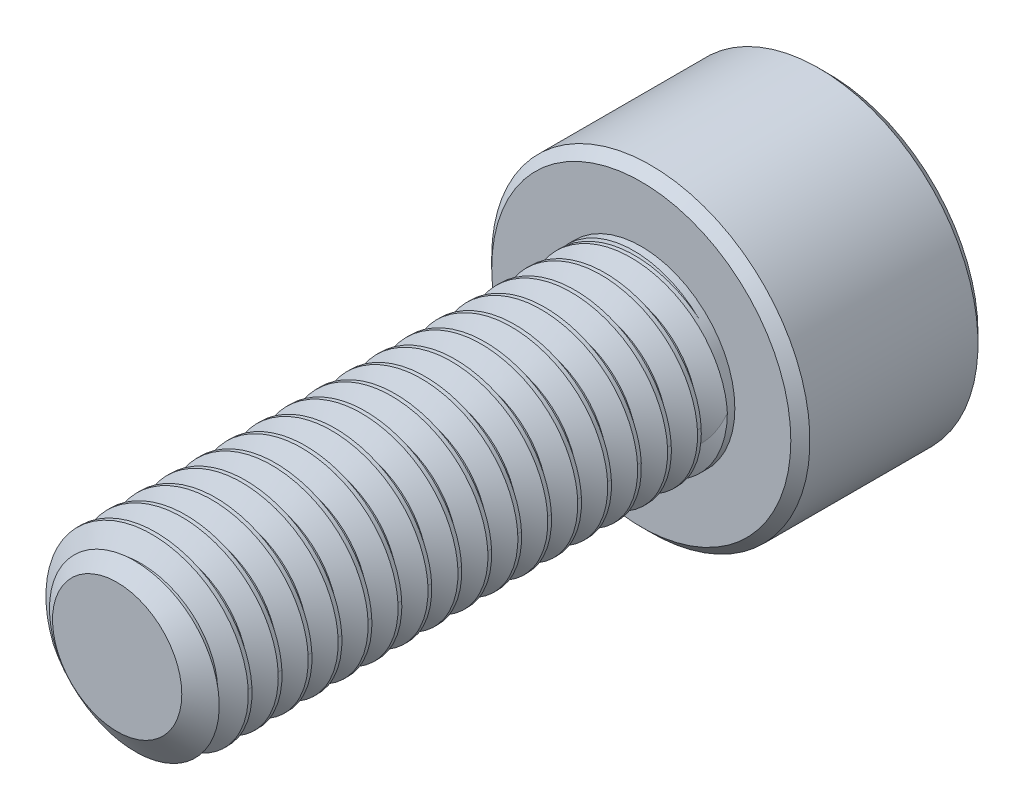
from build123d import *

# Parameters (mm, degrees)
SKETCH1_R          = 2.5
EXTRUDE1_DEPTH     = 14
CUT_SWEEP1_PITCH   = 0.8
SKETCH6_R          = 4.25
EXTRUDE2_DEPTH     = 5
CUT_EXTRUDE1_DEPTH = 3
CHAMFER1_SIZE      = 0.255


with BuildPart() as part:
    # Sketch1 → Extrude1 (new body)
    with BuildSketch(Plane.XY):
        Circle(SKETCH1_R)
    extrude(amount=-EXTRUDE1_DEPTH)

    # Cut-Sweep1: the profile of Sketch3 profile screwed along a right-hand helix of 18.5 turns, 6 arcs to a turn; built about Z, then put on its axis
    cut_sweep1_z = Axis((0, 0, 0), (0, 0, 1))
    cut_sweep1_corners = [(2.5003, 0, -0.700173205), (1.980384758, 0, -0.4), (1.980384758, 0, -0.3), (2.5003, 0, 0.000173205)]
    with BuildLine(mode=Mode.PRIVATE) as cut_sweep1_profile:
        Line(cut_sweep1_corners[0], cut_sweep1_corners[1])
        Line(cut_sweep1_corners[1], cut_sweep1_corners[2])
        Line(cut_sweep1_corners[2], cut_sweep1_corners[3])
        Line(cut_sweep1_corners[3], cut_sweep1_corners[0])
    cut_sweep1_cap = Face(cut_sweep1_profile.wire())
    cut_sweep1_turn_angles = [0, 30, 60, 90, 120, 150, 180, 210, 240, 270, 300, 330, 360]
    cut_sweep1_turn_weights = [1, 0.8660254037844387, 1, 0.8660254037844387, 1, 0.8660254037844387, 1, 0.8660254037844387, 1, 0.8660254037844387, 1, 0.8660254037844387, 1]
    cut_sweep1_turn_rails = [Edge.make_bspline([Vector(p[0], p[1], 0).rotate(cut_sweep1_z, cut_sweep1_turn_angles[k]) / cut_sweep1_turn_weights[k] + Vector(0, 0, p[2] + CUT_SWEEP1_PITCH * cut_sweep1_turn_angles[k] / 360) for k in range(13)], [0, 0, 0, 1, 1, 2, 2, 3, 3, 4, 4, 5, 5, 6, 6, 6], 2, cut_sweep1_turn_weights) for p in cut_sweep1_corners]
    cut_sweep1_turn_sides = [Face.make_surface_from_curves(cut_sweep1_turn_rails[p[0]], cut_sweep1_turn_rails[p[1]]) for p in [(0, 1), (1, 2), (2, 3), (3, 0)]]
    cut_sweep1_last_angles = [6480, 6510, 6540, 6570, 6600, 6630, 6660]
    cut_sweep1_last_weights = [1, 0.8660254037844387, 1, 0.8660254037844387, 1, 0.8660254037843871, 1]
    cut_sweep1_last_rails = [Edge.make_bspline([Vector(p[0], p[1], 0).rotate(cut_sweep1_z, cut_sweep1_last_angles[k]) / cut_sweep1_last_weights[k] + Vector(0, 0, p[2] + CUT_SWEEP1_PITCH * cut_sweep1_last_angles[k] / 360) for k in range(7)], [0, 0, 0, 1, 1, 2, 2, 3, 3, 3], 2, cut_sweep1_last_weights) for p in cut_sweep1_corners]
    cut_sweep1_last_sides = [Face.make_surface_from_curves(cut_sweep1_last_rails[p[0]], cut_sweep1_last_rails[p[1]]) for p in [(0, 1), (1, 2), (2, 3), (3, 0)]]
    cut_sweep1 = Plane(origin=(0, 0, 0), x_dir=(0, 1, 0), z_dir=(0, 0, -1)) * Solid(Shell([*[p.moved(Location((0, 0, CUT_SWEEP1_PITCH * i))) for i in range(18) for p in cut_sweep1_turn_sides], *cut_sweep1_last_sides, cut_sweep1_cap, cut_sweep1_cap.rotate(cut_sweep1_z, 6660).moved(Location((0, 0, CUT_SWEEP1_PITCH * 6660 / 360)))]))
    add(cut_sweep1, mode=Mode.SUBTRACT)

    # Sketch4 → Cut-Revolve1 (revolve, cut)
    with BuildSketch(Plane(origin=(0, 0, 0), x_dir=(0, 0, -1), z_dir=(1, 0, 0)), mode=Mode.PRIVATE) as cut_revolve1_sk:
        Polygon((0.541691224, 2.5), (0, 1.726384758), (0, 2.5), align=None)
    revolve(cut_revolve1_sk.sketch.rotate(Axis((0, 0, 0), (0, 0, -1)), 260.43858876), axis=Axis((0, 0, 0), (0, 0, -1)), mode=Mode.SUBTRACT)

    # Sketch6 → Extrude2 (add)
    with BuildSketch(Plane(origin=(0, 0, -14), x_dir=(-1, 0, 0), z_dir=(0, 0, -1))):
        Circle(SKETCH6_R)
    extrude(amount=EXTRUDE2_DEPTH)

    # Sketch7 → Cut-Extrude1 (cut)
    with BuildSketch(Plane(origin=(0, 0, -19), x_dir=(-1, 0, 0), z_dir=(0, 0, -1))):
        Polygon((0, 2.309401077), (-2, 1.154700538), (-2, -1.154700538), (0, -2.309401077), (2, -1.154700538), (2, 1.154700538), align=None)
    extrude(amount=-CUT_EXTRUDE1_DEPTH, mode=Mode.SUBTRACT)

    # Cut-Extrude2 cone 1 section (through the dimple's axis) → Cut-Extrude2 (revolve, cut)
    with BuildSketch(Plane(origin=(0, 0, -19), x_dir=(0, 1, 0), z_dir=(1, 0, 0))):
        Polygon((0, 0), (2.309401077, 0), (0, 2.309401077), align=None)
    revolve(axis=Axis((0, 0, -19), (0, 0, 1)), mode=Mode.SUBTRACT)

    # Chamfer1
    chamfer1_edges = [part.edges().sort_by_distance(p)[0] for p in [
        (4.25, 0, -14),
        (4.25, 0, -19),
    ]]
    chamfer(chamfer1_edges, length=CHAMFER1_SIZE)

    # Sketch10 → Revolve1 (revolve)
    with BuildSketch(Plane(origin=(0, 0, 0), x_dir=(0, 0, -1), z_dir=(1, 0, 0)), mode=Mode.PRIVATE) as revolve1_sk:
        Polygon((14, 2.5), (14, 0), (12.764466094, 0), (13.8, 2.5), align=None)
    revolve(revolve1_sk.sketch.rotate(Axis((0, 0, -14), (0, 0, 1)), 270), axis=Axis((0, 0, -14), (0, 0, 1)))


solid = part.part
